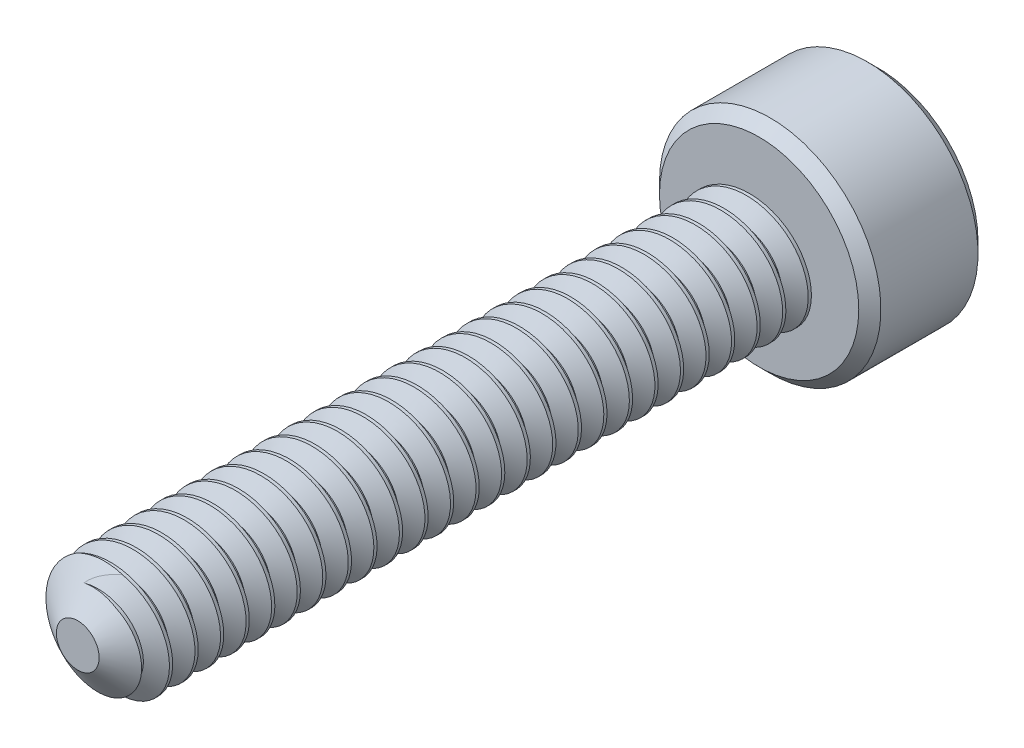
from build123d import *

# Parameters (mm, degrees)
SKETCH1_R          = 0.7
EXTRUDE1_DEPTH     = 8
CUT_SWEEP1_PITCH   = 0.3
SKETCH6_R          = 1.3
EXTRUDE2_DEPTH     = 1.4
CUT_EXTRUDE1_DEPTH = 0.975
CHAMFER1_SIZE      = 0.13


with BuildPart() as part:
    # Sketch1 → Extrude1 (new body)
    with BuildSketch(Plane.XY):
        Circle(SKETCH1_R)
    extrude(amount=-EXTRUDE1_DEPTH)

    # Cut-Sweep1: the profile of Sketch3 profile screwed along a right-hand helix of 27.666667 turns, 6 arcs to a turn; built about Z, then put on its axis
    cut_sweep1_z = Axis((0, 0, 0), (0, 0, 1))
    cut_sweep1_corners = [(0.7003, 0, -0.262673205), (0.505144284, 0, -0.15), (0.505144284, 0, -0.1125), (0.7003, 0, 0.000173205)]
    with BuildLine(mode=Mode.PRIVATE) as cut_sweep1_profile:
        Line(cut_sweep1_corners[0], cut_sweep1_corners[1])
        Line(cut_sweep1_corners[1], cut_sweep1_corners[2])
        Line(cut_sweep1_corners[2], cut_sweep1_corners[3])
        Line(cut_sweep1_corners[3], cut_sweep1_corners[0])
    cut_sweep1_cap = Face(cut_sweep1_profile.wire())
    cut_sweep1_turn_angles = [0, 30, 60, 90, 120, 150, 180, 210, 240, 270, 300, 330, 360]
    cut_sweep1_turn_weights = [1, 0.8660254037844387, 1, 0.8660254037844387, 1, 0.8660254037844387, 1, 0.8660254037844387, 1, 0.8660254037844387, 1, 0.8660254037844387, 1]
    cut_sweep1_turn_rails = [Edge.make_bspline([Vector(p[0], p[1], 0).rotate(cut_sweep1_z, cut_sweep1_turn_angles[k]) / cut_sweep1_turn_weights[k] + Vector(0, 0, p[2] + CUT_SWEEP1_PITCH * cut_sweep1_turn_angles[k] / 360) for k in range(13)], [0, 0, 0, 1, 1, 2, 2, 3, 3, 4, 4, 5, 5, 6, 6, 6], 2, cut_sweep1_turn_weights) for p in cut_sweep1_corners]
    cut_sweep1_turn_sides = [Face.make_surface_from_curves(cut_sweep1_turn_rails[p[0]], cut_sweep1_turn_rails[p[1]]) for p in [(0, 1), (1, 2), (2, 3), (3, 0)]]
    cut_sweep1_last_angles = [9720, 9750, 9780, 9810, 9840, 9870, 9900, 9930, 9960]
    cut_sweep1_last_weights = [1, 0.8660254037844387, 1, 0.8660254037844387, 1, 0.8660254037844387, 1, 0.866025403783637, 1]
    cut_sweep1_last_rails = [Edge.make_bspline([Vector(p[0], p[1], 0).rotate(cut_sweep1_z, cut_sweep1_last_angles[k]) / cut_sweep1_last_weights[k] + Vector(0, 0, p[2] + CUT_SWEEP1_PITCH * cut_sweep1_last_angles[k] / 360) for k in range(9)], [0, 0, 0, 1, 1, 2, 2, 3, 3, 4, 4, 4], 2, cut_sweep1_last_weights) for p in cut_sweep1_corners]
    cut_sweep1_last_sides = [Face.make_surface_from_curves(cut_sweep1_last_rails[p[0]], cut_sweep1_last_rails[p[1]]) for p in [(0, 1), (1, 2), (2, 3), (3, 0)]]
    cut_sweep1 = Plane(origin=(0, 0, 0), x_dir=(0, 1, 0), z_dir=(0, 0, -1)) * Solid(Shell([*[p.moved(Location((0, 0, CUT_SWEEP1_PITCH * i))) for i in range(27) for p in cut_sweep1_turn_sides], *cut_sweep1_last_sides, cut_sweep1_cap, cut_sweep1_cap.rotate(cut_sweep1_z, 9960).moved(Location((0, 0, CUT_SWEEP1_PITCH * 9960 / 360)))]))
    add(cut_sweep1, mode=Mode.SUBTRACT)

    # Sketch4 → Cut-Revolve1 (revolve, cut)
    with BuildSketch(Plane(origin=(0, 0, 0), x_dir=(0, 0, -1), z_dir=(1, 0, 0)), mode=Mode.PRIVATE) as cut_revolve1_sk:
        Polygon((0.314292156, 0.7), (0, 0.251144284), (0, 0.7), align=None)
    revolve(cut_revolve1_sk.sketch.rotate(Axis((0, 0, 0), (0, 0, -1)), 332.054099267), axis=Axis((0, 0, 0), (0, 0, -1)), mode=Mode.SUBTRACT)

    # Sketch6 → Extrude2 (add)
    with BuildSketch(Plane(origin=(0, 0, -8), x_dir=(-1, 0, 0), z_dir=(0, 0, -1))):
        Circle(SKETCH6_R)
    extrude(amount=EXTRUDE2_DEPTH)

    # Sketch7 → Cut-Extrude1 (cut)
    with BuildSketch(Plane(origin=(0, 0, -9.4), x_dir=(-1, 0, 0), z_dir=(0, 0, -1))):
        Polygon((0, 0.75055535), (-0.65, 0.375277675), (-0.65, -0.375277675), (0, -0.75055535), (0.65, -0.375277675), (0.65, 0.375277675), align=None)
    extrude(amount=-CUT_EXTRUDE1_DEPTH, mode=Mode.SUBTRACT)

    # Cut-Extrude2 cone 1 section (through the dimple's axis) → Cut-Extrude2 (revolve, cut)
    with BuildSketch(Plane(origin=(0, 0, -9.4), x_dir=(0, 1, 0), z_dir=(1, 0, 0))):
        Polygon((0, 0), (0.75055535, 0), (0, 0.75055535), align=None)
    revolve(axis=Axis((0, 0, -9.4), (0, 0, 1)), mode=Mode.SUBTRACT)

    # Chamfer1
    chamfer1_edges = [part.edges().sort_by_distance(p)[0] for p in [
        (1.3, 0, -8),
        (1.3, 0, -9.4),
    ]]
    chamfer(chamfer1_edges, length=CHAMFER1_SIZE)


solid = part.part
